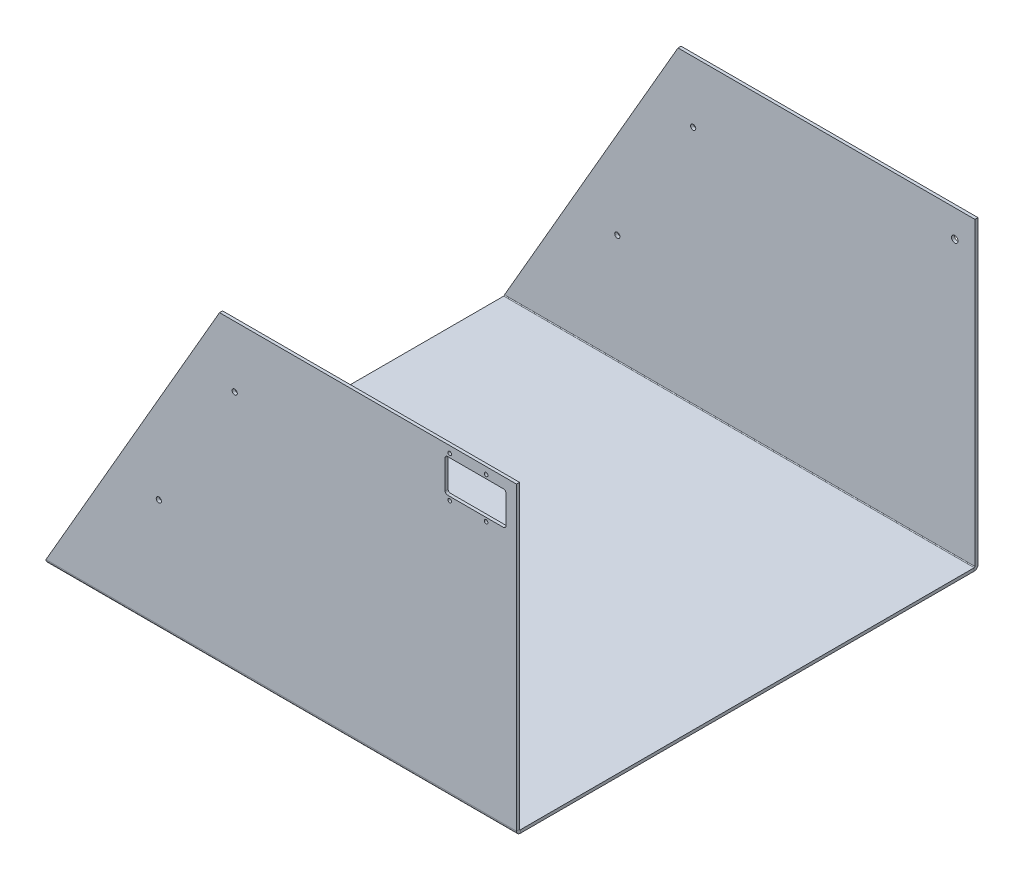
from build123d import *

# Parameters (mm, degrees)
BASE_FLANGE2_DEPTH           = 2
EDGE_FLANGE1_DEPTH           = 309.908043232
EDGE_FLANGE2_STRIP_W         = 9
EDGE_FLANGE2_STRIP_H         = 2
EDGE_FLANGE2_STRIP_CUT_DEPTH = 309.908043232
EDGE_FLANGE2_DEPTH           = 309.908043232
SKETCH23_OUTSIDE_W           = 414.366
SKETCH23_OUTSIDE_H           = 376.458
CUT_EXTRUDE3_DEPTH           = 510.781566222
M3_CLEARANCE_HOLE1_REACH     = 479.133
M3_CLEARANCE_HOLE1_BORE_R    = 1.7
SKETCH50_R                   = 1.2
SKETCH50_W                   = 40
SKETCH50_H                   = 22
CUT_EXTRUDE5_DEPTH           = 10
FILLET1_R                    = 1.5
M4_CLEARANCE_HOLE2_D         = 4.3
M3_CLEARANCE_HOLE2_REACH     = 479.133
M3_CLEARANCE_HOLE2_BORE_R    = 1.7


# Sheet-metal steps are written as plain solids
with BuildPart() as part:
    # Sketch7 → Base-Flange2 (new body)
    with BuildSketch(Plane.XY):
        Polygon((-309.908043232, 0), (-195.602983964, 197.982170213), (0, 197.982170213), (0, 0), align=None)
    extrude(amount=-BASE_FLANGE2_DEPTH)

    # Edge-Flange1 section (across the edge) → Edge-Flange1 (add)
    with BuildSketch(Plane(origin=(0, -0.5, -2), x_dir=(0, 1, 0), z_dir=(-1, 0, 0))):
        with BuildLine():
            Line((-2, 0.5), (-2, 300))
            Line((-2, 300), (0, 300))
            Line((0, 300), (0, 0.5))
            ThreePointArc((0, 0.5), (0.146446609, 0.146446609), (0.5, 0))
            Line((0.5, 0), (0.5, -2))
            ThreePointArc((0.5, -2), (-1.267766953, -1.267766953), (-2, 0.5))
        make_face()
    extrude(amount=EDGE_FLANGE1_DEPTH)

    # Edge-Flange2 strip (across the edge) → Edge-Flange2 strip cut (cut)
    with BuildSketch(Plane(origin=(0, -0.5, -302), x_dir=(0, 0, 1), z_dir=(-1, 0, 0))):
        with Locations((-4, -1)):
            Rectangle(EDGE_FLANGE2_STRIP_W, EDGE_FLANGE2_STRIP_H)
    extrude(amount=EDGE_FLANGE2_STRIP_CUT_DEPTH, mode=Mode.SUBTRACT)

    # Edge-Flange2 section (across the edge) → Edge-Flange2 (add)
    with BuildSketch(Plane(origin=(0, -0.5, -302), x_dir=(0, 0, 1), z_dir=(-1, 0, 0))):
        with BuildLine():
            Line((-2, 0.5), (-2, 270))
            Line((-2, 270), (0, 270))
            Line((0, 270), (0, 0.5))
            ThreePointArc((0, 0.5), (0.146446609, 0.146446609), (0.5, 0))
            Line((0.5, 0), (0.5, -2))
            ThreePointArc((0.5, -2), (-1.267766953, -1.267766953), (-2, 0.5))
        make_face()
    extrude(amount=EDGE_FLANGE2_DEPTH)

    # Sketch23 outside → Cut-Extrude3 (cut, through all)
    with BuildSketch(Plane.XY.offset(-302)):
        with Locations((-154.954, 133.5)):
            Rectangle(SKETCH23_OUTSIDE_W, SKETCH23_OUTSIDE_H)
        Polygon((-309.908043232, 0), (-195.602983964, 197.982170213), (0, 197.982170213), (0, 0), (15.914954138, -38.535343566), (-328.412515317, -22.782185248), align=None, mode=Mode.SUBTRACT)
    extrude(amount=-CUT_EXTRUDE3_DEPTH, mode=Mode.SUBTRACT)

    # M3 Clearance Hole1 bore → M3 Clearance Hole1 (cut, up to next)
    with BuildSketch(Plane(origin=(0, 0, -304), x_dir=(-1, 0, 0), z_dir=(0, 0, -1)), mode=Mode.PRIVATE) as m3_clearance_hole1_sk1:
        with Locations((235.596855298, 71.137815764)):
            Circle(M3_CLEARANCE_HOLE1_BORE_R)
    m3_clearance_hole1_tool1 = extrude(m3_clearance_hole1_sk1.sketch, amount=-M3_CLEARANCE_HOLE1_REACH, mode=Mode.PRIVATE) & part.part
    m3_clearance_hole1 = m3_clearance_hole1_tool1.solids().sort_by_distance((-235.596855, 71.137816, -304))[0]
    add(m3_clearance_hole1, mode=Mode.SUBTRACT)

    # Mirror3: M3 Clearance Hole1 across plane
    add(m3_clearance_hole1.mirror(Plane.XY.offset(-152)), mode=Mode.SUBTRACT)

    # Sketch50 → Cut-Extrude5 (cut)
    with BuildSketch(Plane.XY):
        with Locations((-20, 193.482170213)):
            Circle(SKETCH50_R)
        with Locations((-20, 166.482170213)):
            Circle(SKETCH50_R)
        with Locations((-44, 193.482170213)):
            Circle(SKETCH50_R)
        with Locations((-44, 166.482170213)):
            Circle(SKETCH50_R)
        with Locations((-27, 179.982170213)):
            Rectangle(SKETCH50_W, SKETCH50_H)
    extrude(amount=-CUT_EXTRUDE5_DEPTH, mode=Mode.SUBTRACT)

    # Fillet1
    fillet1_edges = [part.edges().sort_by_distance(p)[0] for p in [
        (-47, 168.982170213, -1),
        (-47, 190.982170213, -1),
        (-7, 190.982170213, -1),
        (-7, 168.982170213, -1),
    ]]
    fillet(fillet1_edges, radius=FILLET1_R)

    # M4 Clearance Hole2 (through all)
    with Locations(Plane(origin=(0, 0, -304), x_dir=(-1, 0, 0), z_dir=(0, 0, -1))):
        with Locations((13.3, 179.982170213)):
            Hole(M4_CLEARANCE_HOLE2_D / 2)

    # M3 Clearance Hole2 bore → M3 Clearance Hole2 (cut, up to next)
    with BuildSketch(Plane(origin=(0, 0, -304), x_dir=(-1, 0, 0), z_dir=(0, 0, -1)), mode=Mode.PRIVATE) as m3_clearance_hole2_sk1:
        with Locations((185.604770825, 157.726646048)):
            Circle(M3_CLEARANCE_HOLE2_BORE_R)
    m3_clearance_hole2_tool1 = extrude(m3_clearance_hole2_sk1.sketch, amount=-M3_CLEARANCE_HOLE2_REACH, mode=Mode.PRIVATE) & part.part
    m3_clearance_hole2 = m3_clearance_hole2_tool1.solids().sort_by_distance((-185.604771, 157.726646, -304))[0]
    add(m3_clearance_hole2, mode=Mode.SUBTRACT)

    # Mirror4: M3 Clearance Hole2 across plane
    add(m3_clearance_hole2.mirror(Plane.XY.offset(-152)), mode=Mode.SUBTRACT)


solid = part.part
